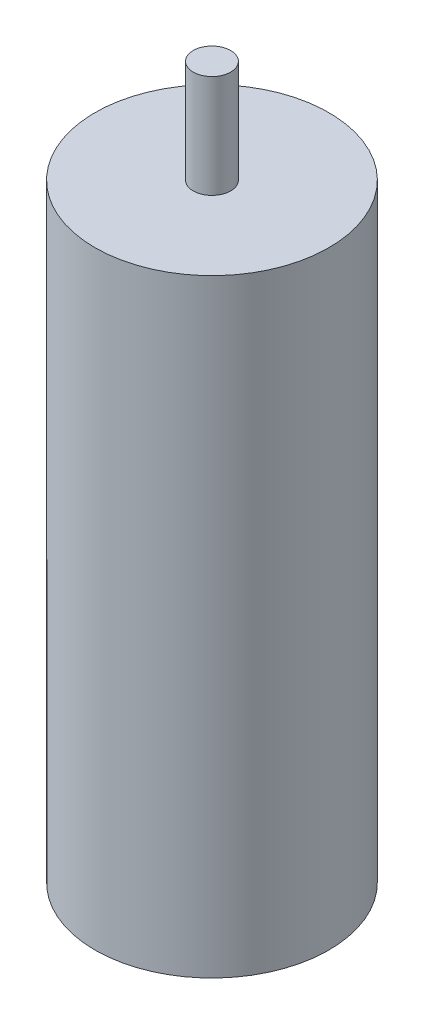
from build123d import *

# Parameters (mm, degrees)
SKETCH1_R           = 12.5
BOSS_EXTRUDE1_DEPTH = 65
SKETCH3_R           = 2
BOSS_EXTRUDE2_DEPTH = 11


with BuildPart() as part:
    # Sketch1 → Boss-Extrude1 (new body)
    with BuildSketch(Plane(origin=(0, 0, 0), x_dir=(1, 0, 0), z_dir=(0, 1, 0))):
        Circle(SKETCH1_R)
    extrude(amount=BOSS_EXTRUDE1_DEPTH)

    # Sketch3 → Boss-Extrude2 (add)
    with BuildSketch(Plane(origin=(0, 65, 0), x_dir=(1, 0, 0), z_dir=(0, 1, 0))):
        Circle(SKETCH3_R)
    extrude(amount=BOSS_EXTRUDE2_DEPTH)


solid = part.part
